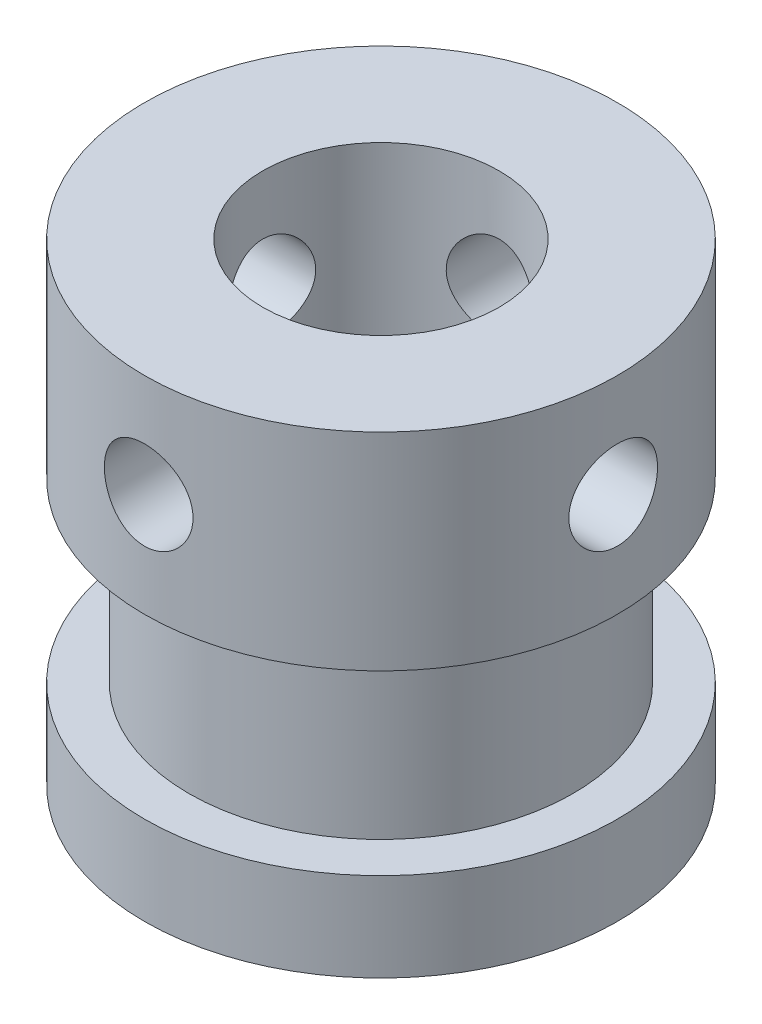
from build123d import *

# Parameters (mm, degrees)
SKETCH_1_R               = 8
EXTRUDE_1_DEPTH          = 16
SKETCH_2_R               = 4
CUT_EXTRUDE_1_DEPTH      = 20.595917942
SKETCH_3_OUTSIDE_W       = 23.542
SKETCH_3_OUTSIDE_H       = 23.542
SKETCH_3_OUTSIDE_R       = 6.5
CUT_EXTRUDE_2_DEPTH      = 6
CUT_EXTRUDE_3_DEPTH      = 20.595917942
CUT_EXTRUDE_3_DEPTH_BACK = 20.595917942
SKETCH_4_R               = 1.5
CUT_EXTRUDE_4_DEPTH      = 20.595918106
CUT_EXTRUDE_4_DEPTH_BACK = 20.595918106
SKETCH_5_R               = 1.5


with BuildPart() as part:
    # 草图1 → 凸台-拉伸1 (new body)
    with BuildSketch(Plane(origin=(0, 0, 0), x_dir=(1, 0, 0), z_dir=(0, 1, 0))):
        Circle(SKETCH_1_R)
    extrude(amount=EXTRUDE_1_DEPTH)

    # 草图2 → 切除-拉伸1 (cut, through all)
    with BuildSketch(Plane(origin=(0, 16, 0), x_dir=(1, 0, 0), z_dir=(0, 1, 0))):
        Circle(SKETCH_2_R)
    extrude(amount=-CUT_EXTRUDE_1_DEPTH, mode=Mode.SUBTRACT)

    # 草图3 outside → 切除-拉伸2 (cut)
    with BuildSketch(Plane(origin=(0, 3, 0), x_dir=(1, 0, 0), z_dir=(0, 1, 0))):
        Rectangle(SKETCH_3_OUTSIDE_W, SKETCH_3_OUTSIDE_H)
        Circle(SKETCH_3_OUTSIDE_R, mode=Mode.SUBTRACT)
    extrude(amount=CUT_EXTRUDE_2_DEPTH, mode=Mode.SUBTRACT)

    # 草图4 → 切除-拉伸3 (cut, two sides: drawn at the far end of the back side and taken through both)
    with BuildSketch(Plane(origin=(0, 0, 0), x_dir=(0, 0, -1), z_dir=(1, 0, 0)).offset(-CUT_EXTRUDE_3_DEPTH_BACK)):
        with Locations((0, 12.5)):
            Circle(SKETCH_4_R)
    extrude(amount=CUT_EXTRUDE_3_DEPTH + CUT_EXTRUDE_3_DEPTH_BACK, mode=Mode.SUBTRACT)

    # 草图5 → 切除-拉伸4 (cut, two sides: drawn at the far end of the back side and taken through both)
    with BuildSketch(Plane.XY.offset(-CUT_EXTRUDE_4_DEPTH_BACK)):
        with Locations((0, 12.5)):
            Circle(SKETCH_5_R)
    extrude(amount=CUT_EXTRUDE_4_DEPTH + CUT_EXTRUDE_4_DEPTH_BACK, mode=Mode.SUBTRACT)


solid = part.part
